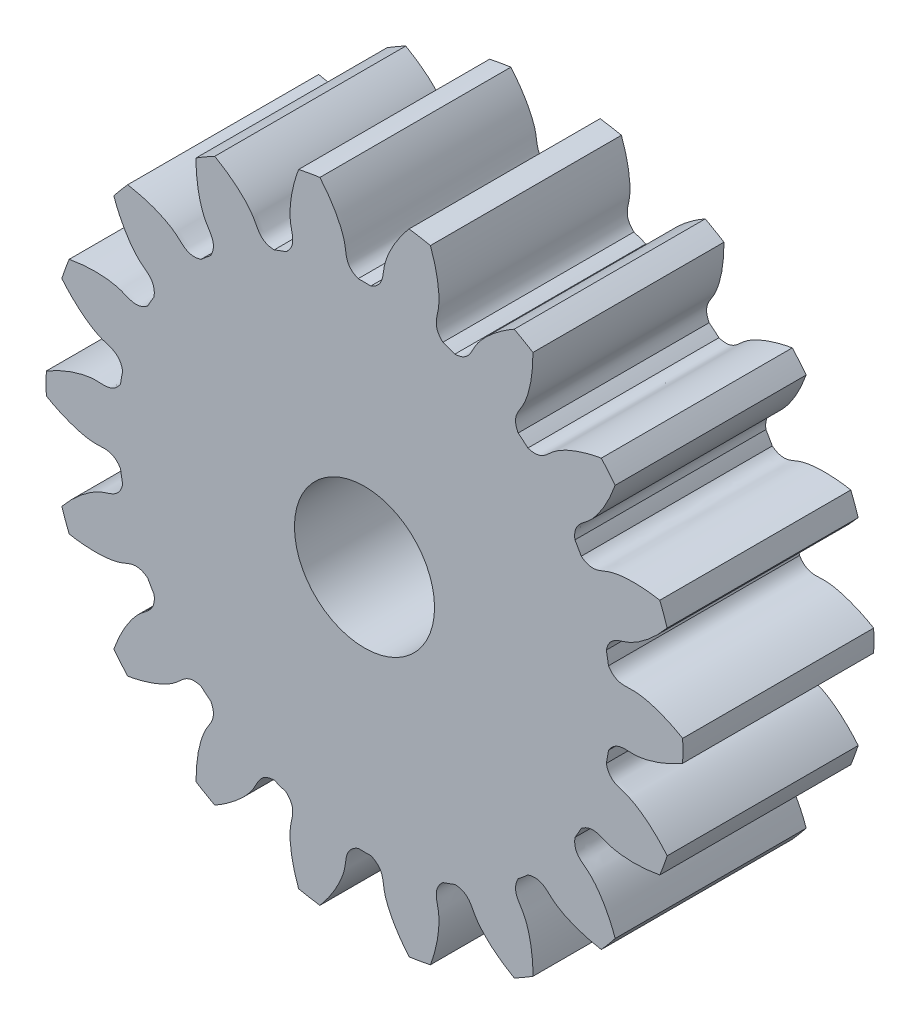
from build123d import *

# Parameters (mm, degrees)
SKETCH_1_R               = 5
EXTRUDE_1_DEPTH          = 3
CUT_EXTRUDE_1_DEPTH      = 8.681145748
PATTERN_CIRCULAR_1_COUNT = 18
CUT_EXTRUDE_2_REACH      = 9.649
SKETCH_4_R               = 1.1


with BuildPart() as part:
    # 草图1 → 凸台-拉伸1 (new body)
    with BuildSketch(Plane.XY):
        Circle(SKETCH_1_R)
    extrude(amount=EXTRUDE_1_DEPTH)

    # 草图2 → 切除-拉伸1 (cut, through all)
    with BuildSketch(Plane.XY):
        with BuildLine():
            ThreePointArc((0.09970178, 3.87371715), (0, 3.875), (-0.09970178, 3.87371715))
            add(Edge.make_bspline(
                [(-0.09970178, 3.87371715), (-0.30755202, 3.959340195), (-0.281394525, 4.119349751), (-0.315916457, 4.271297728), (-0.31937576, 4.2852533), (-0.323553797, 4.300770237), (-0.328512355, 4.317825091), (-0.334315015, 4.336392084), (-0.341023859, 4.356443666), (-0.348700427, 4.377950366), (-0.357405358, 4.400880864), (-0.367198437, 4.425201998), (-0.378138513, 4.450878789), (-0.39028346, 4.477874466), (-0.403690129, 4.50615049), (-0.418414299, 4.535666583), (-0.434510628, 4.566380752), (-0.452032612, 4.598249322), (-0.471032538, 4.631226962), (-0.491561435, 4.66526672), (-0.513669036, 4.700320051), (-0.537403731, 4.736336856), (-0.562812528, 4.77326551), (-0.589941007, 4.811052903), (-0.618833286, 4.849644473), (-0.649531974, 4.888984245), (-0.682078137, 4.929014872), (-0.716511262, 4.969677669), (-0.752869213, 5.010912657), (-0.791188202, 5.052658607), (-0.831502751, 5.094853076), (-0.87384566, 5.137432457), (-0.918247973, 5.180332018), (-0.964738945, 5.223485948), (-1.013346016, 5.266827406), (-1.064094777, 5.310288565), (-1.117008944, 5.353800659), (-1.17211033, 5.39729403), (-1.22941882, 5.440698182), (-1.288952349, 5.483941823), (-1.350726862, 5.526952923), (-1.437037676, 5.584519758), (-1.503777719, 5.626166889), (-1.549280445, 5.65333919)],
                knots=[0, 0, 0, 0, 0.187591972, 0.192996016, 0.1991206, 0.205965723, 0.213531386, 0.221817587, 0.230824328, 0.240551609, 0.250999428, 0.262167787, 0.274056685, 0.286666122, 0.299996099, 0.314046614, 0.32881767, 0.344309264, 0.360521397, 0.37745407, 0.395107283, 0.413481034, 0.432575325, 0.452390155, 0.472925524, 0.494181432, 0.51615788, 0.538854867, 0.562272393, 0.586410459, 0.611269064, 0.636848208, 0.663147891, 0.690168114, 0.717908876, 0.746370177, 0.775552017, 0.805454397, 0.836077316, 0.867420774, 0.899484772, 0.932269309, 1, 1, 1, 1], degree=3))
            ThreePointArc((-1.549280445, 5.65333919), (0, 5.86178419), (1.549280445, 5.65333919))
            add(Edge.make_bspline(
                [(0.09970178, 3.87371715), (0.30755202, 3.959340195), (0.281394525, 4.119349751), (0.315916457, 4.271297728), (0.31937576, 4.2852533), (0.323553797, 4.300770237), (0.328512355, 4.317825091), (0.334315015, 4.336392084), (0.341023859, 4.356443666), (0.348700427, 4.377950366), (0.357405358, 4.400880864), (0.367198437, 4.425201998), (0.378138513, 4.450878789), (0.39028346, 4.477874466), (0.403690129, 4.50615049), (0.418414299, 4.535666583), (0.434510628, 4.566380752), (0.452032612, 4.598249322), (0.471032538, 4.631226962), (0.491561435, 4.66526672), (0.513669036, 4.700320051), (0.537403731, 4.736336856), (0.562812528, 4.77326551), (0.589941007, 4.811052903), (0.618833286, 4.849644473), (0.649531974, 4.888984245), (0.682078137, 4.929014872), (0.716511262, 4.969677669), (0.752869213, 5.010912657), (0.791188202, 5.052658607), (0.831502751, 5.094853076), (0.87384566, 5.137432457), (0.918247973, 5.180332018), (0.964738945, 5.223485948), (1.013346016, 5.266827406), (1.064094777, 5.310288565), (1.117008944, 5.353800659), (1.17211033, 5.39729403), (1.22941882, 5.440698182), (1.288952349, 5.483941823), (1.350726862, 5.526952923), (1.437037676, 5.584519758), (1.503777719, 5.626166889), (1.549280445, 5.65333919)],
                knots=[0, 0, 0, 0, 0.187591972, 0.192996016, 0.1991206, 0.205965723, 0.213531386, 0.221817587, 0.230824328, 0.240551609, 0.250999428, 0.262167787, 0.274056685, 0.286666122, 0.299996099, 0.314046614, 0.32881767, 0.344309264, 0.360521397, 0.37745407, 0.395107283, 0.413481034, 0.432575325, 0.452390155, 0.472925524, 0.494181432, 0.51615788, 0.538854867, 0.562272393, 0.586410459, 0.611269064, 0.636848208, 0.663147891, 0.690168114, 0.717908876, 0.746370177, 0.775552017, 0.805454397, 0.836077316, 0.867420774, 0.899484772, 0.932269309, 1, 1, 1, 1], degree=3))
        make_face()
    cut_extrude_1 = extrude(amount=CUT_EXTRUDE_1_DEPTH, mode=Mode.SUBTRACT)

    # 阵列(圆周)1: 切除-拉伸1 ×18 about axis
    pattern_circular_1_axis = Axis((0, 0, 3), (0, 0, -1))
    for i in range(1, PATTERN_CIRCULAR_1_COUNT):
        add(cut_extrude_1.rotate(pattern_circular_1_axis, i * 360 / PATTERN_CIRCULAR_1_COUNT), mode=Mode.SUBTRACT)

    # 草图4 → 切除-拉伸2 (cut, up to next)
    with BuildSketch(Plane(origin=(0, 0, 0), x_dir=(-1, 0, 0), z_dir=(0, 0, -1)), mode=Mode.PRIVATE) as cut_extrude_2_sk1:
        Circle(SKETCH_4_R)
    cut_extrude_2_tool1 = extrude(cut_extrude_2_sk1.sketch, amount=-CUT_EXTRUDE_2_REACH, mode=Mode.PRIVATE) & part.part
    add(cut_extrude_2_tool1.solids().sort_by_distance((0, 0, 0))[0], mode=Mode.SUBTRACT)


solid = part.part
